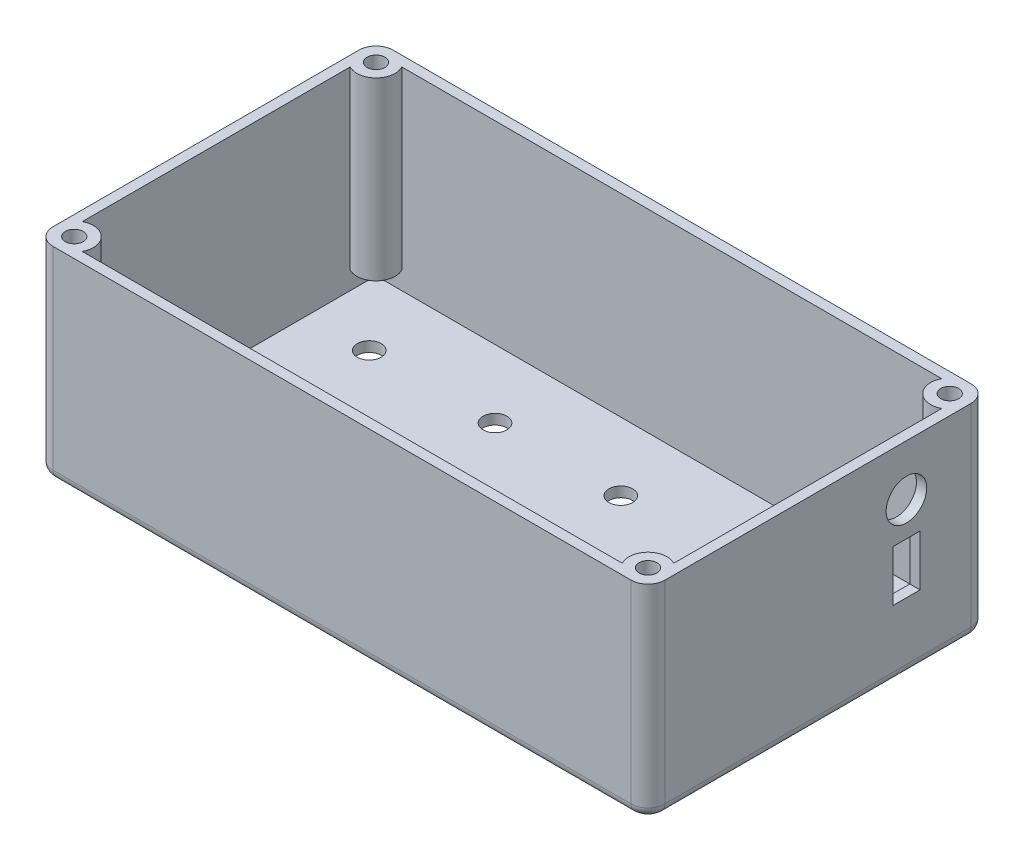
from build123d import *

# Parameters (mm, degrees)
SKETCH1_W                 = 180
SKETCH1_H                 = 100
BOSS_EXTRUDE1_DEPTH       = 60
F_3_0MM_DOWEL_HOLE1_D     = 5.25
F_3_0MM_DOWEL_HOLE1_DEPTH = 50
F_3_0MM_DOWEL_HOLE1_TIP   = 1.577259125
SHELL2_START              = 3
SHELL2_DEPTH              = 57
SHELL2_2_DEPTH            = 5.302681665
FILLET1_R                 = 5
FILLET2_R                 = 3
SKETCH4_R                 = 5.959707521
SKETCH4_W                 = 8
SKETCH4_H                 = 15
CUT_EXTRUDE1_DEPTH        = 10
SKETCH6_R                 = 5.5
CUT_EXTRUDE2_DEPTH        = 10
SKETCH9_R                 = 3.5
SKETCH9_R_2               = 5
SKETCH9_R_3               = 4
CUT_EXTRUDE3_DEPTH        = 7
SKETCH10_R                = 4
CUT_EXTRUDE4_DEPTH        = 10


with BuildPart() as part:
    # Sketch1 → Boss-Extrude1 (new body)
    with BuildSketch(Plane(origin=(0, 0, 0), x_dir=(1, 0, 0), z_dir=(0, 1, 0))):
        with Locations((90, -50)):
            Rectangle(SKETCH1_W, SKETCH1_H)
    extrude(amount=BOSS_EXTRUDE1_DEPTH)

    # Ø3.0mm Dowel Hole1
    with Locations(Plane(origin=(0, 60, 0), x_dir=(1, 0, 0), z_dir=(0, 1, 0))):
        with Locations((5.625, -5.625), (174.375, -5.625), (5.625, -94.375), (174.375, -94.375)):
            Hole(F_3_0MM_DOWEL_HOLE1_D / 2, depth=F_3_0MM_DOWEL_HOLE1_DEPTH)
            with Locations((0, 0, -(F_3_0MM_DOWEL_HOLE1_DEPTH + F_3_0MM_DOWEL_HOLE1_TIP / 2))):  # 118° drill point
                Cone(0, F_3_0MM_DOWEL_HOLE1_D / 2, F_3_0MM_DOWEL_HOLE1_TIP, mode=Mode.SUBTRACT)

    # Shell2: read off the stored shape, not the designer's step
    # Shell2 outline → Shell2 (cut)
    with BuildSketch(Plane(origin=(0, 0, 0), x_dir=(1, 0, 0), z_dir=(0, 1, 0)).offset(SHELL2_START)):
        with BuildLine():
            Line((169.400062814, -3), (10.599937186, -3))
            ThreePointArc((10.599937186, -3), (9.602475644, -9.602475644), (3, -10.599937186))
            Line((3, -10.599937186), (3, -89.400062814))
            ThreePointArc((3, -89.400062814), (9.602475644, -90.397524356), (10.599937186, -97))
            Line((10.599937186, -97), (169.400062814, -97))
            ThreePointArc((169.400062814, -97), (170.397524356, -90.397524356), (177, -89.400062814))
            Line((177, -89.400062814), (177, -10.599937186))
            ThreePointArc((177, -10.599937186), (170.397524356, -9.602475644), (169.400062814, -3))
        make_face()
    extrude(amount=SHELL2_DEPTH, mode=Mode.SUBTRACT)

    # Shell2 2 outline → Shell2 2 (cut)
    with BuildSketch(Plane(origin=(0, 0, 0), x_dir=(1, 0, 0), z_dir=(0, 1, 0)).offset(SHELL2_START)):
        with BuildLine():
            Line((10.599937186, -3), (3, -3))
            Line((3, -3), (3, -10.599937186))
            ThreePointArc((3, -10.599937186), (9.602475644, -9.602475644), (10.599937186, -3))
        make_face()
        with BuildLine():
            Line((177, -3), (169.400062814, -3))
            ThreePointArc((169.400062814, -3), (170.397524356, -9.602475644), (177, -10.599937186))
            Line((177, -10.599937186), (177, -3))
        make_face()
        with BuildLine():
            ThreePointArc((10.599937186, -97), (9.602475644, -90.397524356), (3, -89.400062814))
            Line((3, -89.400062814), (3, -97))
            Line((3, -97), (10.599937186, -97))
        make_face()
        with BuildLine():
            Line((177, -97), (177, -89.400062814))
            ThreePointArc((177, -89.400062814), (170.397524356, -90.397524356), (169.400062814, -97))
            Line((169.400062814, -97), (177, -97))
        make_face()
    extrude(amount=SHELL2_2_DEPTH, mode=Mode.SUBTRACT)

    # Shell2 3 outline → Shell2 3 (revolve)
    with BuildSketch(Plane(origin=(5.625, 0, 94.375), x_dir=(1, 0, 0), z_dir=(0, 0, 1))):
        Polygon((0, 8.302681673), (0, 4.922840683), (5.625000013, 8.302681673), align=None)
    revolve(axis=Axis((5.625, 0, 94.375), (0, 1, 0)))

    # Shell2 4 outline → Shell2 4 (revolve)
    with BuildSketch(Plane(origin=(174.375, 0, 94.375), x_dir=(1, 0, 0), z_dir=(0, 0, 1))):
        Polygon((0, 8.302681665), (0, 4.922840683), (5.625, 8.302681665), align=None)
    revolve(axis=Axis((174.375, 0, 94.375), (0, 1, 0)))

    # Shell2 5 outline → Shell2 5 (revolve)
    with BuildSketch(Plane(origin=(174.375, 0, 5.625), x_dir=(1, 0, 0), z_dir=(0, 0, 1))):
        Polygon((0, 8.302681673), (0, 4.922840683), (5.625000013, 8.302681673), align=None)
    revolve(axis=Axis((174.375, 0, 5.625), (0, 1, 0)))

    # Shell2 6 outline → Shell2 6 (revolve)
    with BuildSketch(Plane(origin=(5.625, 0, 5.625), x_dir=(1, 0, 0), z_dir=(0, 0, 1))):
        Polygon((0, 8.302681673), (0, 4.922840683), (5.625000013, 8.302681673), align=None)
    revolve(axis=Axis((5.625, 0, 5.625), (0, 1, 0)))

    # Fillet1
    fillet1_edges = [part.edges().sort_by_distance(p)[0] for p in [
        (0, 30, 0),
        (180, 30, 0),
        (180, 30, 100),
        (0, 30, 100),
    ]]
    fillet(fillet1_edges, radius=FILLET1_R)

    # Fillet2
    fillet2_edges = [part.edges().sort_by_distance(p)[0] for p in [
        (0, 0, 50),
        (90, 0, 0),
        (180, 0, 50),
        (90, 0, 100),
        (1.464466094, 0, 98.535533906),
        (178.535533906, 0, 98.535533906),
        (178.535533906, 0, 1.464466094),
        (1.464466094, 0, 1.464466094),
    ]]
    fillet(fillet2_edges, radius=FILLET2_R)

    # Sketch4 → Cut-Extrude1 (cut)
    with BuildSketch(Plane(origin=(180, 0, 0), x_dir=(0, 0, -1), z_dir=(1, 0, 0))):
        with Locations((-24, 45)):
            Circle(SKETCH4_R)
        with Locations((-24, 27.5)):
            Rectangle(SKETCH4_W, SKETCH4_H)
    extrude(amount=-CUT_EXTRUDE1_DEPTH, mode=Mode.SUBTRACT)

    # Sketch6 → Cut-Extrude2 (cut)
    with BuildSketch(Plane.XZ):
        with Locations(Location((25.5, 82, 0), (0, 0, 270))):
            Circle(SKETCH6_R)
        with Locations(Location((48, 82, 0), (0, 0, 270))):
            Circle(SKETCH6_R)
    extrude(amount=-CUT_EXTRUDE2_DEPTH, mode=Mode.SUBTRACT)

    # Sketch9 → Cut-Extrude3 (cut)
    with BuildSketch(Plane.XZ):
        with Locations(Location((21, 23, 0), (0, 0, 270))):
            Circle(SKETCH9_R)
        with Locations(Location((58, 23, 0), (0, 0, 270))):
            Circle(SKETCH9_R)
        with Locations(Location((95, 23, 0), (0, 0, 270))):
            Circle(SKETCH9_R)
        with Locations(Location((21, 52.813509344, 0), (0, 0, 270))):
            Circle(SKETCH9_R_2)
        with Locations(Location((58, 52.813509344, 0), (0, 0, 270))):
            Circle(SKETCH9_R)
        with Locations(Location((95, 52.813509344, 0), (0, 0, 270))):
            Circle(SKETCH9_R_3)
    extrude(amount=-CUT_EXTRUDE3_DEPTH, mode=Mode.SUBTRACT)

    # Sketch10 → Cut-Extrude4 (cut)
    with BuildSketch(Plane.XZ):
        with Locations(Location((76.5, 81.714376639, 0), (0, 0, 270))):
            Circle(SKETCH10_R)
    extrude(amount=-CUT_EXTRUDE4_DEPTH, mode=Mode.SUBTRACT)


solid = part.part
